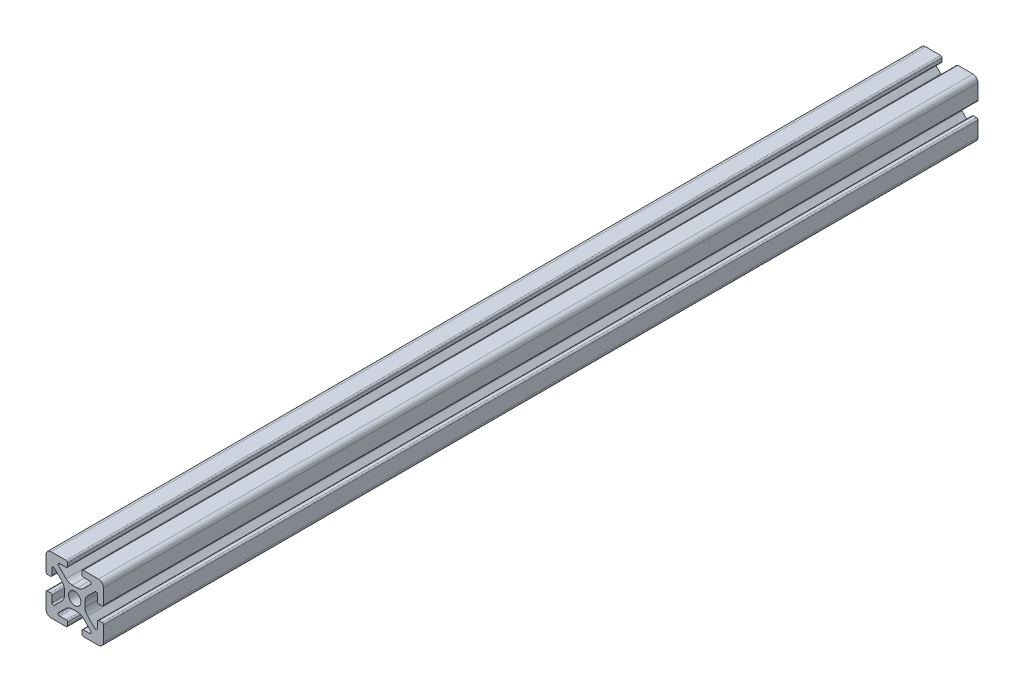
from build123d import *

# Parameters (mm, degrees)
BOSS_EXTRUDE1_DEPTH = 152.4


with BuildPart() as part:
    # Sketch4 → Boss-Extrude1 (new, symmetric)
    with BuildSketch(Plane.XY):
        with BuildLine():
            Line((3, -10), (8.25, -10))
            ThreePointArc((8.25, -10), (9.487436867, -9.487436867), (10, -8.25))
            Line((10, -8.25), (10, -3))
            ThreePointArc((10, -3), (9.853553391, -2.646446609), (9.5, -2.5))
            Line((9.5, -2.5), (8.424621202, -2.5))
            ThreePointArc((8.424621202, -2.5), (8.071067812, -2.646446609), (7.924621202, -3))
            Line((7.924621202, -3), (7.924621202, -5.25))
            ThreePointArc((7.924621202, -5.25), (7.615962919, -5.711939766), (7.071067812, -5.603553391))
            Line((7.071067812, -5.603553391), (4.478679656, -3.011165235))
            ThreePointArc((4.478679656, -3.011165235), (3.828361402, -2.037895189), (3.6, -0.889844892))
            Line((3.6, -0.889844892), (3.6, 0))
            Line((3.6, 0), (2.15, 0))
            ThreePointArc((2.15, 0), (1.52027958, -1.52027958), (0, -2.15))
            Line((0, -2.15), (0, -3.6))
            Line((0, -3.6), (0.889844892, -3.6))
            ThreePointArc((0.889844892, -3.6), (2.037895189, -3.828361402), (3.011165235, -4.478679656))
            Line((3.011165235, -4.478679656), (5.603553391, -7.071067812))
            ThreePointArc((5.603553391, -7.071067812), (5.711939766, -7.615962919), (5.25, -7.924621202))
            Line((5.25, -7.924621202), (3, -7.924621202))
            ThreePointArc((3, -7.924621202), (2.646446609, -8.071067812), (2.5, -8.424621202))
            Line((2.5, -8.424621202), (2.5, -9.5))
            ThreePointArc((2.5, -9.5), (2.646446609, -9.853553391), (3, -10))
        make_face()
    extrude(amount=BOSS_EXTRUDE1_DEPTH, both=True)

    # Mirror1: part across plane


with BuildPart() as part_1:
    add(part.part)
    add(part.part.mirror(Plane(origin=(0, 0, 0), x_dir=(0, 0, 1), z_dir=(1, 0, 0))))

    # Mirror2: part across plane


with BuildPart() as part_2:
    add(part_1.part)
    add(part_1.part.mirror(Plane.ZX))


solid = part_2.part
